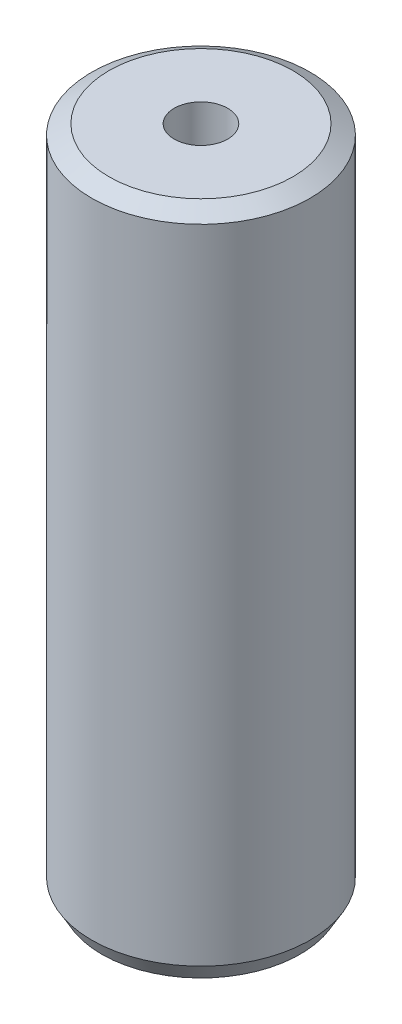
from build123d import *
from OCP.BRepFilletAPI import BRepFilletAPI_MakeChamfer

# Parameters (mm, degrees)
SKETCH1_R           = 10
BOSS_EXTRUDE1_DEPTH = 61.312789764
SKETCH2_R           = 2.449537163
CUT_EXTRUDE1_DEPTH  = 63.922636536
CHAMFER1_SIZE       = 0.911141155
CHAMFER1_SIZE2      = 1.578142774


with BuildPart() as part:
    # Sketch1 → Boss-Extrude1 (new body)
    with BuildSketch(Plane(origin=(0, 0, 0), x_dir=(1, 0, 0), z_dir=(0, 1, 0))):
        Circle(SKETCH1_R)
    extrude(amount=BOSS_EXTRUDE1_DEPTH)

    # Sketch2 → Cut-Extrude1 (cut, through all)
    with BuildSketch(Plane(origin=(0, 0, 0), x_dir=(1, 0, 0), z_dir=(0, 1, 0))):
        Circle(SKETCH2_R)
    extrude(amount=CUT_EXTRUDE1_DEPTH, mode=Mode.SUBTRACT)

    # Chamfer1: one chamfer whose edges measure the first distance from different faces: ONE call of the kernel's chamfer builder (chamfer() names one face for all edges)
    chamfer1_edges_1 = [part.edges().sort_by_distance(p)[0] for p in [
        (-10, 61.312789764, 0),
    ]]
    chamfer1_side_1 = [part.faces().sort_by_distance(p)[0] for p in [
        (-10, 30.656394882, 0),
    ]]
    chamfer1_edges_2 = [part.edges().sort_by_distance(p)[0] for p in [
        (-10, 0, 0),
    ]]
    chamfer1_side_2 = [part.faces().sort_by_distance(p)[0] for p in [
        (-9.717157288, 0, 0),
    ]]
    chamfer1 = BRepFilletAPI_MakeChamfer(part.part.solid().wrapped)
    for e in chamfer1_edges_1:
        chamfer1.Add(CHAMFER1_SIZE, CHAMFER1_SIZE2, e.wrapped, chamfer1_side_1[0].wrapped)  # the first distance lies on this face
    for e in chamfer1_edges_2:
        chamfer1.Add(CHAMFER1_SIZE, CHAMFER1_SIZE2, e.wrapped, chamfer1_side_2[0].wrapped)  # the first distance lies on this face
    add(Compound.cast(chamfer1.Shape()), mode=Mode.REPLACE)


solid = part.part
